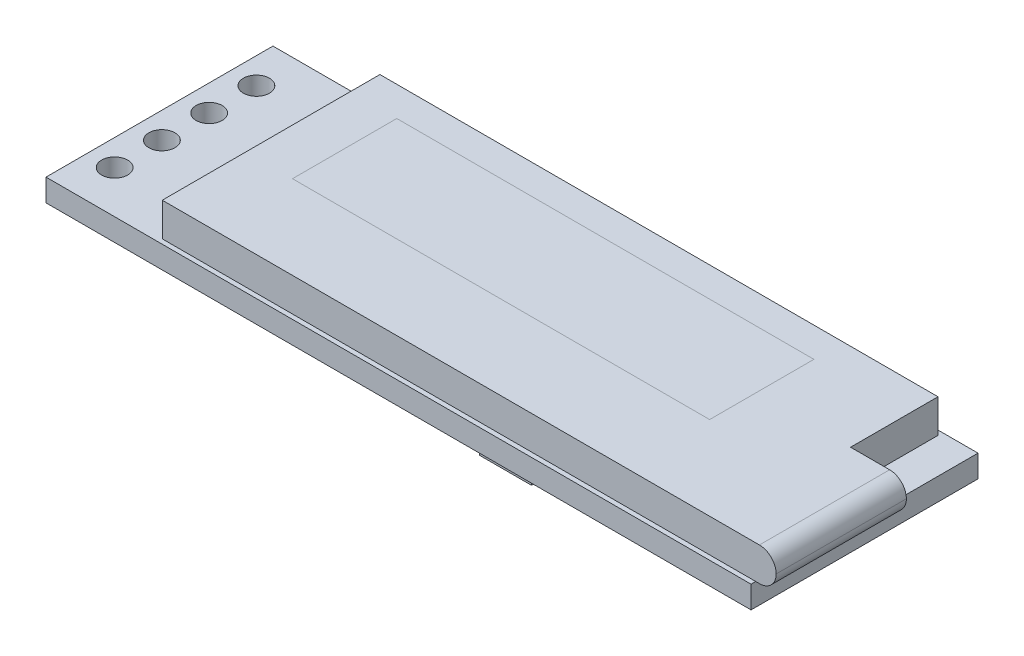
from build123d import *

# Parameters (mm, degrees)
SKETCH_1_W          = 37.9
SKETCH_1_H          = 12.2
EXTRUDE_1_DEPTH     = 1.2
EXTRUDE_2_DEPTH     = 1.8
FILLET_1_R          = 0.9
SKETCH_4_R          = 0.7
CUT_EXTRUDE_1_DEPTH = 22.034554904
SKETCH_5_W          = 2.8
SKETCH_5_H          = 10.1
SKETCH_5_H_2        = 8
SKETCH_5_W_2        = 4
SKETCH_5_H_3        = 7.4
EXTRUDE_3_DEPTH     = 0.8


with BuildPart() as part:
    # Эскиз1 → Бобышка-Вытянуть1 (new body)
    with BuildSketch(Plane(origin=(0, 0, 0), x_dir=(1, 0, 0), z_dir=(0, 1, 0))):
        Rectangle(SKETCH_1_W, SKETCH_1_H)
    extrude(amount=EXTRUDE_1_DEPTH)

    # Эскиз2 → Бобышка-Вытянуть2 (add)
    with BuildSketch(Plane(origin=(0, 1.2, 0), x_dir=(1, 0, 0), z_dir=(0, 1, 0))):
        Polygon((-12.95, 5.85), (17.05, 5.85), (17.05, 1.15), (20.05, 1.15), (20.05, -5.85), (17.05, -5.85), (-12.95, -5.85), align=None)
    extrude(amount=EXTRUDE_2_DEPTH)

    # Скругление1
    fillet_1_edges = [part.edges().sort_by_distance(p)[0] for p in [
        (20.05, 1.2, 2.35),
        (20.05, 3, 2.35),
    ]]
    fillet(fillet_1_edges, radius=FILLET_1_R - 0.0001)  # a hair under: the kernel refuses the full size

    # Эскиз4 → Вырез-Вытянуть1 (cut, through all)
    with BuildSketch(Plane(origin=(0, 1.2, 0), x_dir=(1, 0, 0), z_dir=(0, 1, 0))):
        with Locations(Location((-17.55, 3.81, 0), (0, 0, 270))):
            Circle(SKETCH_4_R)
        with Locations(Location((-17.55, 1.27, 0), (0, 0, 270))):
            Circle(SKETCH_4_R)
        with Locations(Location((-17.55, -1.27, 0), (0, 0, 270))):
            Circle(SKETCH_4_R)
        with Locations(Location((-17.55, -3.81, 0), (0, 0, 270))):
            Circle(SKETCH_4_R)
    extrude(amount=-CUT_EXTRUDE_1_DEPTH, mode=Mode.SUBTRACT)

    # Эскиз5 → Бобышка-Вытянуть3 (add)
    with BuildSketch(Plane.XZ):
        with Locations((5.05, 0.35)):
            Rectangle(SKETCH_5_W, SKETCH_5_H)
        with Locations((-2.05, 0.7)):
            Rectangle(SKETCH_5_W, SKETCH_5_H_2)
        with Locations((-9.55, 0.6)):
            Rectangle(SKETCH_5_W_2, SKETCH_5_H_3)
    extrude(amount=EXTRUDE_3_DEPTH)


solid = part.part
